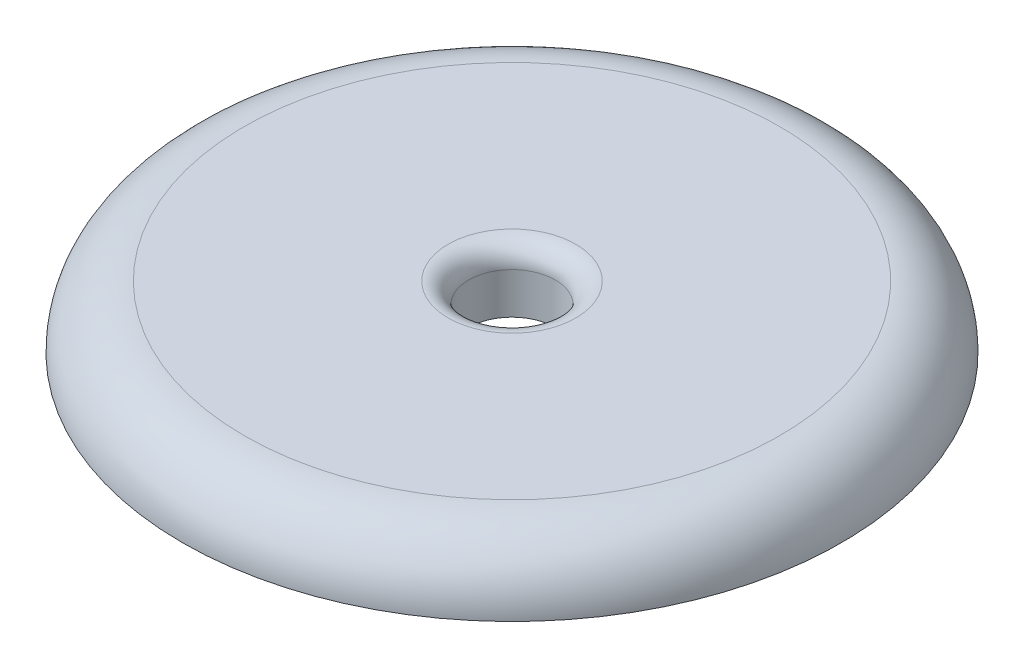
from build123d import *

# Parameters (mm, degrees)
SKETCH_1_R      = 16
SKETCH_1_R_2    = 2.1
EXTRUDE_1_DEPTH = 3
FILLET_1_R      = 3
FILLET_2_R      = 1


with BuildPart() as part:
    # Эскиз1 → Бобышка-Вытянуть1 (new body)
    with BuildSketch(Plane(origin=(0, 0, 0), x_dir=(1, 0, 0), z_dir=(0, 1, 0))):
        with Locations(Location((0, 0.566108198, 0), (0, 0, 270))):
            Circle(SKETCH_1_R)
        with Locations(Location((0, 0.566108198, 0), (0, 0, 270))):
            Circle(SKETCH_1_R_2, mode=Mode.SUBTRACT)
    extrude(amount=EXTRUDE_1_DEPTH)

    # Скругление1
    fillet_1_edges = [part.edges().sort_by_distance(p)[0] for p in [
        (0, 3, -16.566108198),
    ]]
    fillet(fillet_1_edges, radius=FILLET_1_R - 0.0001)  # a hair under: the kernel refuses the full size

    # Скругление2
    fillet_2_edges = [part.edges().sort_by_distance(p)[0] for p in [
        (0, 3, -2.666108198),
    ]]
    fillet(fillet_2_edges, radius=FILLET_2_R)


solid = part.part
